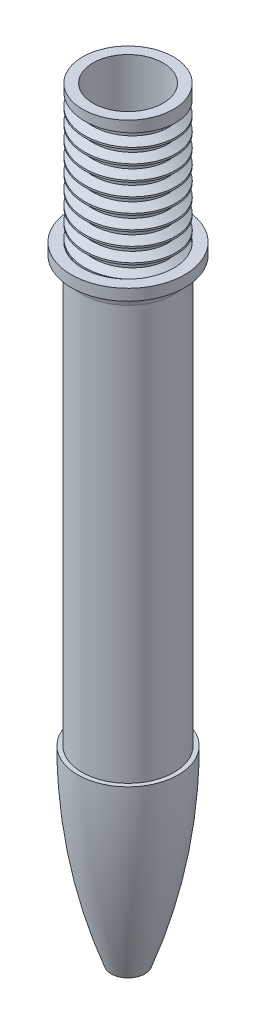
from build123d import *

# Parameters (mm, degrees)
THREAD1_PITCH = 1.27


with BuildPart() as part:
    # Sketch1 → Revolve1 (revolve)
    with BuildSketch(Plane.XY, mode=Mode.PRIVATE) as revolve1_sk:
        with BuildLine():
            Line((-4.04, 67.85), (-4.04, 55.61))
            Line((-4.04, 55.61), (-5.04, 55.61))
            Line((-5.04, 55.61), (-5.04, 54.61))
            Line((-5.04, 54.61), (-4.285, 54.61))
            Line((-4.285, 54.61), (-4.095, 53.618926859))
            Line((-4.095, 53.618926859), (-4.095, 16.82))
            Line((-4.095, 16.82), (-4.475, 16.82))
            ThreePointArc((-4.475, 16.82), (-3.725522382, 8.279463937), (-1.5, 0))
            Line((-1.5, 0), (-1.5, 5.6))
            Line((-1.5, 5.6), (-2.62, 5.6))
            Line((-2.62, 5.6), (-2.62, 10.6))
            Line((-2.62, 10.6), (-3.11, 10.6))
            Line((-3.11, 10.6), (-3.11, 67.85))
            Line((-3.11, 67.85), (-4.04, 67.85))
        make_face()
    revolve(revolve1_sk.sketch.rotate(Axis((0, 0, 0), (0, 1, 0)), 270), axis=Axis((0, 0, 0), (0, 1, 0)))

    # Thread1: the profile of Thread Profile1 profile screwed along a left-hand helix of 9.244094 turns, 8 arcs to a turn; built about Z, then put on its axis
    thread1_z = Axis((0, 0, 0), (0, 0, 1))
    thread1_corners = [(4.0406, 0, -0.00034641), (4.0406, 0, 1.111596407), (3.352592339, 0, 0.714374998), (3.352592339, 0, 0.396874998)]
    with BuildLine(mode=Mode.PRIVATE) as thread1_profile:
        Line(thread1_corners[0], thread1_corners[1])
        Line(thread1_corners[1], thread1_corners[2])
        Line(thread1_corners[2], thread1_corners[3])
        Line(thread1_corners[3], thread1_corners[0])
    thread1_cap = Face(thread1_profile.wire())
    thread1_turn_angles = [0, -22.5, -45, -67.5, -90, -112.5, -135, -157.5, -180, -202.5, -225, -247.5, -270, -292.5, -315, -337.5, -360]
    thread1_turn_weights = [1, 0.9238795325112867, 1, 0.9238795325112867, 1, 0.9238795325112867, 1, 0.9238795325112867, 1, 0.9238795325112867, 1, 0.9238795325112867, 1, 0.9238795325112867, 1, 0.9238795325112867, 1]
    thread1_turn_rails = [Edge.make_bspline([Vector(p[0], p[1], 0).rotate(thread1_z, thread1_turn_angles[k]) / thread1_turn_weights[k] + Vector(0, 0, p[2] + -THREAD1_PITCH * thread1_turn_angles[k] / 360) for k in range(17)], [0, 0, 0, 1, 1, 2, 2, 3, 3, 4, 4, 5, 5, 6, 6, 7, 7, 8, 8, 8], 2, thread1_turn_weights) for p in thread1_corners]
    thread1_turn_sides = [Face.make_surface_from_curves(thread1_turn_rails[p[0]], thread1_turn_rails[p[1]]) for p in [(0, 1), (1, 2), (2, 3), (3, 0)]]
    thread1_last_angles = [-3240, -3262.5, -3285, -3306.437007874, -3327.874015748]
    thread1_last_weights = [1, 0.9238795325112867, 1, 0.9308199443708746, 1]
    thread1_last_rails = [Edge.make_bspline([Vector(p[0], p[1], 0).rotate(thread1_z, thread1_last_angles[k]) / thread1_last_weights[k] + Vector(0, 0, p[2] + -THREAD1_PITCH * thread1_last_angles[k] / 360) for k in range(5)], [0, 0, 0, 1, 1, 2, 2, 2], 2, thread1_last_weights) for p in thread1_corners]
    thread1_last_sides = [Face.make_surface_from_curves(thread1_last_rails[p[0]], thread1_last_rails[p[1]]) for p in [(0, 1), (1, 2), (2, 3), (3, 0)]]
    thread1 = Plane(origin=(0, 67.35, 0), x_dir=(-1, 0, 0), z_dir=(0, -1, 0)) * Solid(Shell([*[p.moved(Location((0, 0, THREAD1_PITCH * i))) for i in range(9) for p in thread1_turn_sides], *thread1_last_sides, thread1_cap, thread1_cap.rotate(thread1_z, -3327.874015748).moved(Location((0, 0, -THREAD1_PITCH * -3327.874015748 / 360)))]))
    add(thread1, mode=Mode.SUBTRACT)


solid = part.part
